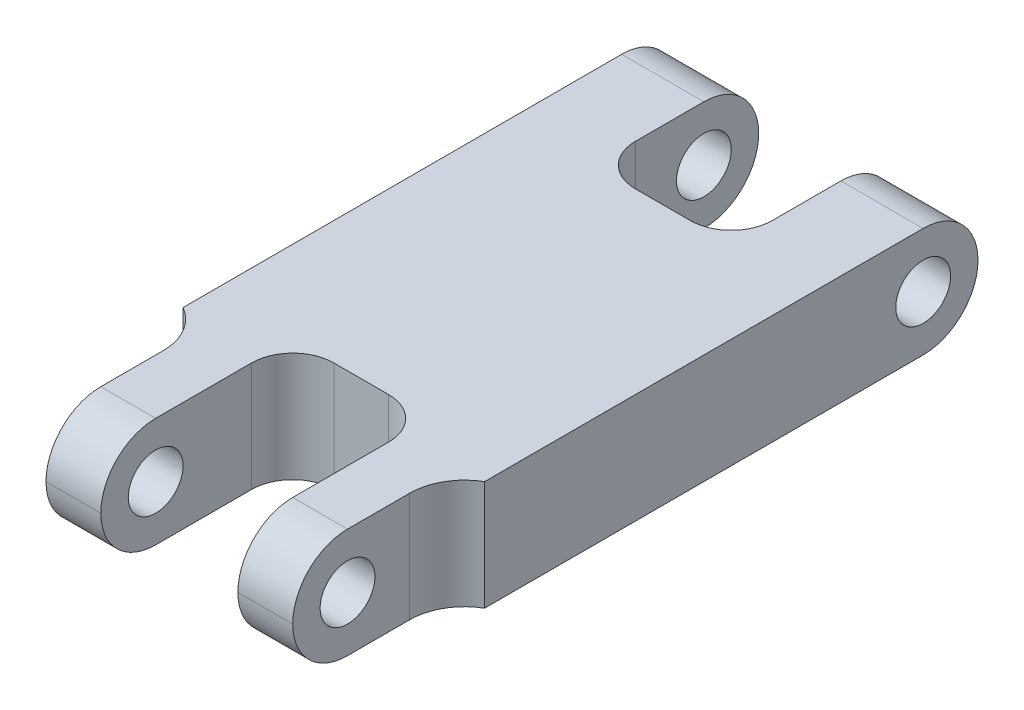
from build123d import *

# Parameters (mm, degrees)
SKETCH4_W           = 34.925
SKETCH4_H           = 12.7
BOSS_EXTRUDE2_DEPTH = 76.2
SKETCH6_W           = 15.875
SKETCH6_H           = 22.225
SKETCH6_H_2         = 19.05
CUT_EXTRUDE4_DEPTH  = 80.200182489
FILLET3_R           = 6.35
SKETCH7_R           = 3.175
CUT_EXTRUDE5_DEPTH  = 85.062584572
FILLET4_R           = 4.7625
FILLET5_R           = 4.7625
SKETCH8_W           = 3.175
SKETCH8_H           = 19.05
CUT_EXTRUDE6_DEPTH  = 80.200182489
FILLET6_R           = 6.35


# Some blends are built 0.0001 mm under size
with BuildPart() as part:
    # Sketch4 → Boss-Extrude2 (new body)
    with BuildSketch(Plane.XY):
        Rectangle(SKETCH4_W, SKETCH4_H)
    extrude(amount=BOSS_EXTRUDE2_DEPTH)

    # Sketch6 → Cut-Extrude4 (cut, through all)
    with BuildSketch(Plane(origin=(0, 6.35, 0), x_dir=(1, 0, 0), z_dir=(0, 1, 0))):
        with Locations((0, -65.0875)):
            Rectangle(SKETCH6_W, SKETCH6_H)
        with Locations((0, -9.525)):
            Rectangle(SKETCH6_W, SKETCH6_H_2)
    extrude(amount=-CUT_EXTRUDE4_DEPTH, mode=Mode.SUBTRACT)

    # Fillet3
    fillet3_edges = [part.edges().sort_by_distance(p)[0] for p in [
        (-12.7, -6.35, 0),
        (12.7, -6.35, 0),
        (-12.7, 6.35, 0),
        (12.7, 6.35, 0),
        (12.7, -6.35, 76.2),
        (12.7, 6.35, 76.2),
        (-12.7, -6.35, 76.2),
        (-12.7, 6.35, 76.2),
    ]]
    fillet(fillet3_edges, radius=FILLET3_R - 0.0001)  # a hair under: the kernel refuses the full size

    # Sketch7 → Cut-Extrude5 (cut, through all)
    with BuildSketch(Plane(origin=(17.4625, 0, 0), x_dir=(0, 0, -1), z_dir=(1, 0, 0))):
        with Locations((-6.35, 0)):
            Circle(SKETCH7_R)
        with Locations((-69.85, 0)):
            Circle(SKETCH7_R)
    extrude(amount=-CUT_EXTRUDE5_DEPTH, mode=Mode.SUBTRACT)

    # Fillet4
    fillet4_edges = [part.edges().sort_by_distance(p)[0] for p in [
        (-7.9375, 0, 19.05),
        (7.9375, 0, 19.05),
    ]]
    fillet(fillet4_edges, radius=FILLET4_R)

    # Fillet5
    fillet5_edges = [part.edges().sort_by_distance(p)[0] for p in [
        (-7.9375, 0, 53.975),
        (7.9375, 0, 53.975),
    ]]
    fillet(fillet5_edges, radius=FILLET5_R)

    # Sketch8 → Cut-Extrude6 (cut, through all)
    with BuildSketch(Plane(origin=(0, 6.35, 0), x_dir=(1, 0, 0), z_dir=(0, 1, 0))):
        with Locations((15.875, -66.675)):
            Rectangle(SKETCH8_W, SKETCH8_H)
        with Locations((-15.875, -66.675)):
            Rectangle(SKETCH8_W, SKETCH8_H)
    extrude(amount=-CUT_EXTRUDE6_DEPTH, mode=Mode.SUBTRACT)

    # Fillet6
    # the kernel refuses this fillet: 6.35 mm, written as the material it adds along each edge
    with BuildSketch(Plane(origin=(-14.2875, 6.35, 57.15), x_dir=(0, 0, 1), z_dir=(0, -1, 0))) as fillet6_piece_1:
        with BuildLine():
            CenterArc((5.499261314, 6.35), FILLET6_R, 210, 60)
            Line((0, 3.175), (-0.109985226, 3.1115))
            ThreePointArc((-0.109985226, 3.1115), (-0.127, 1.5875), (-0.127, 0))
            Line((-0.127, 0), (0, -0.127))
            Line((0, -0.127), (5.499261314, -0.127))
            Line((5.499261314, -0.127), (5.499261314, 0))
        make_face()
    extrude(amount=12.7)
    with BuildSketch(Plane(origin=(14.2875, 6.35, 57.15), x_dir=(1, 0, 0), z_dir=(0, -1, 0))) as fillet6_piece_2:
        with BuildLine():
            CenterArc((6.35, 5.499261314), FILLET6_R, 180, 60)
            Line((0, 5.499261314), (-0.127, 5.499261314))
            Line((-0.127, 5.499261314), (-0.127, 0))
            Line((-0.127, 0), (0, -0.127))
            ThreePointArc((0, -0.127), (1.5875, -0.127), (3.1115, -0.109985226))
            Line((3.1115, -0.109985226), (3.175, 0))
        make_face()
    extrude(amount=12.7)


solid = part.part
